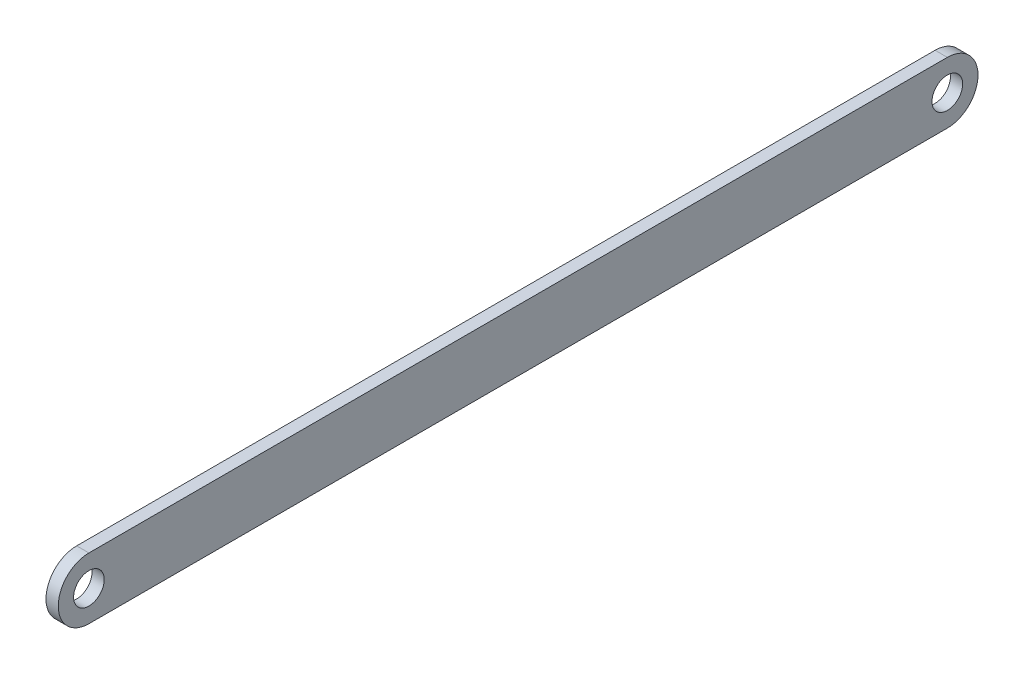
from build123d import *

# Parameters (mm, degrees)
SKETCH1_R           = 2.5
BOSS_EXTRUDE1_DEPTH = 1


with BuildPart() as part:
    # Sketch1 → Boss-Extrude1 (new, symmetric)
    with BuildSketch(Plane(origin=(0, 0, 0), x_dir=(0, 0, -1), z_dir=(1, 0, 0))):
        with BuildLine():
            Line((-70, 5), (70, 5))
            ThreePointArc((70, 5), (75, 0), (70, -5))
            Line((70, -5), (-70, -5))
            ThreePointArc((-70, -5), (-75, 0), (-70, 5))
        make_face()
        with Locations((-70, 0)):
            Circle(SKETCH1_R, mode=Mode.SUBTRACT)
        with Locations((70, 0)):
            Circle(SKETCH1_R, mode=Mode.SUBTRACT)
    extrude(amount=BOSS_EXTRUDE1_DEPTH, both=True)


solid = part.part
